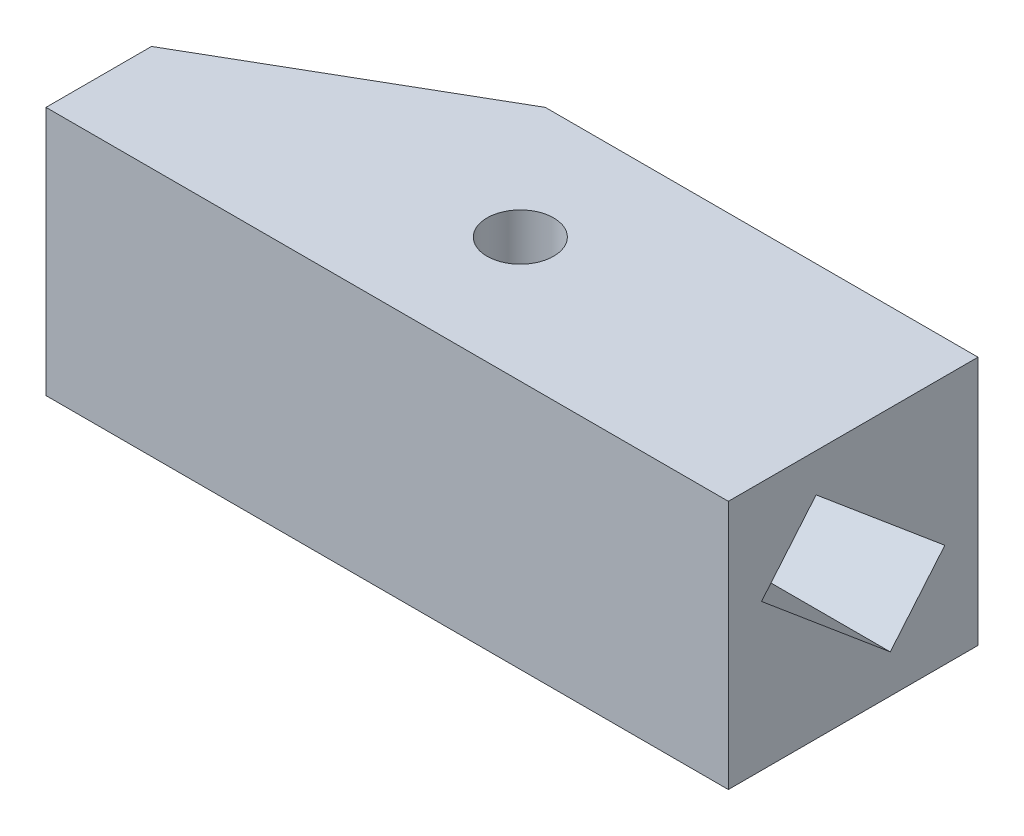
from build123d import *

# Parameters (mm, degrees)
EXTRUDE_1_DEPTH     = 30
SKETCH_2_R          = 4
CUT_EXTRUDE_1_DEPTH = 49.476798574
CUT_EXTRUDE_4_DEPTH = 25
SKETCH1_W           = 30
SKETCH1_H           = 30
BOSS_EXTRUDE1_DEPTH = 27
CHAMFER1_SIZE       = 30
CHAMFER1_SIZE2      = 17.320508076


with BuildPart() as part:
    # Эскиз1 → Бобышка-Вытянуть1 (new body)
    with BuildSketch(Plane(origin=(0, 0, 0), x_dir=(1, 0, 0), z_dir=(0, 1, 0))):
        Polygon((-20, -15), (-35, -15), (-35, 15), (-20, 15), (20, 15), (20, -15), align=None)
    extrude(amount=EXTRUDE_1_DEPTH)

    # Эскиз2 → Вырез-Вытянуть1 (cut, through all)
    with BuildSketch(Plane(origin=(0, 30, 0), x_dir=(1, 0, 0), z_dir=(0, 1, 0))):
        with Locations((-20, 0)):
            Circle(SKETCH_2_R)
    extrude(amount=-CUT_EXTRUDE_1_DEPTH, mode=Mode.SUBTRACT)

    # Эскиз5 → Вырез-Вытянуть4 (cut)
    with BuildSketch(Plane(origin=(20, 0, 0), x_dir=(0, 0, -1), z_dir=(1, 0, 0))):
        Polygon((4.458832066, 4.601018482), (11.015265685, 12.414671802), (-4.458832066, 25.398981518), (-11.015265685, 17.585328198), align=None)
    extrude(amount=-CUT_EXTRUDE_4_DEPTH, mode=Mode.SUBTRACT)

    # Sketch1 → Boss-Extrude1 (add)
    with BuildSketch(Plane.ZY.offset(35)):
        with Locations((0, 15)):
            Rectangle(SKETCH1_W, SKETCH1_H)
    extrude(amount=BOSS_EXTRUDE1_DEPTH)

    # Chamfer1
    chamfer1_edges = [part.edges().sort_by_distance(p)[0] for p in [
        (-62, 15, -15),
    ]]
    chamfer1_side = [part.faces().sort_by_distance(p)[0] for p in [
        (-21, 15, -15),
    ]]
    chamfer(chamfer1_edges, length=CHAMFER1_SIZE, length2=CHAMFER1_SIZE2, reference=chamfer1_side[0])


solid = part.part
